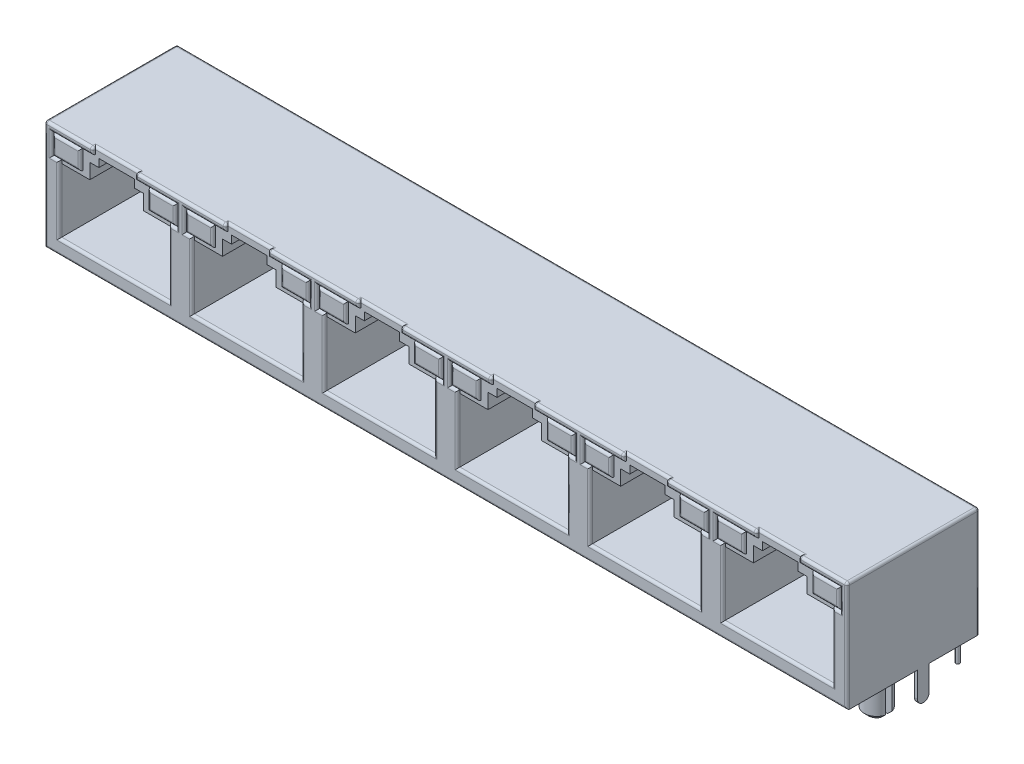
from build123d import *

# Parameters (mm, degrees)
SKETCH_1_W          = 95.25
SKETCH_1_H          = 15.7
EXTRUDE_1_DEPTH     = 13.05
SKETCH_2_R          = 1.48
EXTRUDE_2_DEPTH     = 3.7
CUT_EXTRUDE_1_DEPTH = 13
CUT_EXTRUDE_2_DEPTH = 0.3
SKETCH_5_W          = 3.3
SKETCH_5_H          = 2.3
EXTRUDE_4_DEPTH     = 0.3
FILLET_2_R          = 0.3
EXTRUDE_5_DEPTH     = 0.35
EXTRUDE_START       = -0.35
EXTRUDE_6_DEPTH     = 0.35
EXTRUDE_7_DEPTH     = 0.35
CUT_EXTRUDE_4_DEPTH = 1.65
SKETCH_12_R         = 0.225
EXTRUDE_8_DEPTH     = 3.01
CHAMFER_1_SIZE      = 0.5
CUT_EXTRUDE_5_REACH = 114.88
FILLET_3_R          = 0.3


with BuildPart() as part:
    # 草图1 → 凸台-拉伸1 (new body)
    with BuildSketch(Plane(origin=(0, 0, 0), x_dir=(1, 0, 0), z_dir=(0, 1, 0))):
        with Locations((62.895283232, 7.85)):
            Rectangle(SKETCH_1_W, SKETCH_1_H)
    extrude(amount=EXTRUDE_1_DEPTH)

    # 草图2 → 凸台-拉伸2 (add)
    with BuildSketch(Plane.XZ):
        with Locations(Location((17.170283232, -5.4, 0), (0, 0, 90))):
            Circle(SKETCH_2_R)
        with Locations(Location((108.620283232, -5.4, 0), (0, 0, 90))):
            Circle(SKETCH_2_R)
    extrude(amount=EXTRUDE_2_DEPTH)

    # 草图3 → 切除-拉伸1 (cut)
    with BuildSketch(Plane.XY):
        Polygon((64.270283232, 1.76), (77.270283232, 1.76), (77.270283232, 9.32), (73.945283232, 9.32), (73.945283232, 11.11), (72.870283232, 11.11), (72.870283232, 12.05), (68.670283232, 12.05), (68.670283232, 11.11), (67.595283232, 11.11), (67.595283232, 9.32), (64.270283232, 9.32), align=None)
        Polygon((80.020283232, 1.76), (93.020283232, 1.76), (93.020283232, 9.32), (89.695283232, 9.32), (89.695283232, 11.11), (88.620283232, 11.11), (88.620283232, 12.05), (84.420283232, 12.05), (84.420283232, 11.11), (83.345283232, 11.11), (83.345283232, 9.32), (80.020283232, 9.32), align=None)
        Polygon((95.770283232, 1.76), (108.770283232, 1.76), (108.770283232, 9.32), (105.445283232, 9.32), (105.445283232, 11.11), (104.370283232, 11.11), (104.370283232, 12.05), (100.170283232, 12.05), (100.170283232, 11.11), (99.095283232, 11.11), (99.095283232, 9.32), (95.770283232, 9.32), align=None)
        Polygon((48.520283232, 1.76), (61.520283232, 1.76), (61.520283232, 9.32), (58.195283232, 9.32), (58.195283232, 11.11), (57.120283232, 11.11), (57.120283232, 12.05), (52.920283232, 12.05), (52.920283232, 11.11), (51.845283232, 11.11), (51.845283232, 9.32), (48.520283232, 9.32), align=None)
        Polygon((32.770283232, 1.76), (45.770283232, 1.76), (45.770283232, 9.32), (42.445283232, 9.32), (42.445283232, 11.11), (41.370283232, 11.11), (41.370283232, 12.05), (37.170283232, 12.05), (37.170283232, 11.11), (36.095283232, 11.11), (36.095283232, 9.32), (32.770283232, 9.32), align=None)
        Polygon((17.020283232, 1.76), (30.020283232, 1.76), (30.020283232, 9.32), (26.695283232, 9.32), (26.695283232, 11.11), (25.620283232, 11.11), (25.620283232, 12.05), (21.420283232, 12.05), (21.420283232, 11.11), (20.345283232, 11.11), (20.345283232, 9.32), (17.020283232, 9.32), align=None)
    extrude(amount=-CUT_EXTRUDE_1_DEPTH, mode=Mode.SUBTRACT)

    # 草图4 → 切除-拉伸2 (cut)
    with BuildSketch(Plane.XY):
        Polygon((21.020283232, 13.05), (26.020283232, 13.05), (26.020283232, 12.25), (30.920283232, 12.25), (30.920283232, 9.73), (30.020283232, 9.73), (30.020283232, 9.32), (17.020283232, 9.32), (17.020283232, 9.73), (16.120283232, 9.73), (16.120283232, 12.25), (21.020283232, 12.25), align=None)
        Polygon((36.770283232, 13.05), (41.770283232, 13.05), (41.770283232, 12.25), (46.670283232, 12.25), (46.670283232, 9.73), (45.770283232, 9.73), (45.770283232, 9.32), (32.770283232, 9.32), (32.770283232, 9.73), (31.870283232, 9.73), (31.870283232, 12.25), (36.770283232, 12.25), align=None)
        Polygon((52.520283232, 13.05), (57.520283232, 13.05), (57.520283232, 12.25), (62.420283232, 12.25), (62.420283232, 9.73), (61.520283232, 9.73), (61.520283232, 9.32), (48.520283232, 9.32), (48.520283232, 9.73), (47.620283232, 9.73), (47.620283232, 12.25), (52.520283232, 12.25), align=None)
        Polygon((68.270283232, 13.05), (73.270283232, 13.05), (73.270283232, 12.25), (78.170283232, 12.25), (78.170283232, 9.73), (77.270283232, 9.73), (77.270283232, 9.32), (64.270283232, 9.32), (64.270283232, 9.73), (63.370283232, 9.73), (63.370283232, 12.25), (68.270283232, 12.25), align=None)
        Polygon((84.020283232, 13.05), (89.020283232, 13.05), (89.020283232, 12.25), (93.920283232, 12.25), (93.920283232, 9.73), (93.020283232, 9.73), (93.020283232, 9.32), (80.020283232, 9.32), (80.020283232, 9.73), (79.120283232, 9.73), (79.120283232, 12.25), (84.020283232, 12.25), align=None)
        Polygon((99.770283232, 13.05), (104.770283232, 13.05), (104.770283232, 12.25), (109.670283232, 12.25), (109.670283232, 9.73), (108.770283232, 9.73), (108.770283232, 9.32), (95.770283232, 9.32), (95.770283232, 9.73), (94.870283232, 9.73), (94.870283232, 12.25), (99.770283232, 12.25), align=None)
    extrude(amount=-CUT_EXTRUDE_2_DEPTH, mode=Mode.SUBTRACT)

    # 草图5 → 凸台-拉伸4 (add)
    with BuildSketch(Plane.XY.offset(-0.3)):
        with Locations((44.920283232, 11)):
            Rectangle(SKETCH_5_W, SKETCH_5_H)
        with Locations((29.170283232, 11)):
            Rectangle(SKETCH_5_W, SKETCH_5_H)
        with Locations((17.870283232, 11)):
            Rectangle(SKETCH_5_W, SKETCH_5_H)
        with Locations((33.620283232, 11)):
            Rectangle(SKETCH_5_W, SKETCH_5_H)
        with Locations((60.670283232, 11)):
            Rectangle(SKETCH_5_W, SKETCH_5_H)
        with Locations((49.370283232, 11)):
            Rectangle(SKETCH_5_W, SKETCH_5_H)
        with Locations((76.420283232, 11)):
            Rectangle(SKETCH_5_W, SKETCH_5_H)
        with Locations((65.120283232, 11)):
            Rectangle(SKETCH_5_W, SKETCH_5_H)
        with Locations((92.170283232, 11)):
            Rectangle(SKETCH_5_W, SKETCH_5_H)
        with Locations((80.870283232, 11)):
            Rectangle(SKETCH_5_W, SKETCH_5_H)
        with Locations((107.920283232, 11)):
            Rectangle(SKETCH_5_W, SKETCH_5_H)
        with Locations((96.620283232, 11)):
            Rectangle(SKETCH_5_W, SKETCH_5_H)
    extrude(amount=EXTRUDE_4_DEPTH)

    # 圆角2
    fillet_2_edges = [part.edges().sort_by_distance(p)[0] for p in [
        (106.270283232, 11, 0),
        (107.920283232, 12.15, 0),
        (109.570283232, 11, 0),
        (107.920283232, 9.85, 0),
        (96.620283232, 9.85, 0),
        (94.970283232, 11, 0),
        (96.620283232, 12.15, 0),
        (98.270283232, 11, 0),
        (90.520283232, 11, 0),
        (92.170283232, 12.15, 0),
        (93.820283232, 11, 0),
        (92.170283232, 9.85, 0),
        (80.870283232, 9.85, 0),
        (79.220283232, 11, 0),
        (80.870283232, 12.15, 0),
        (82.520283232, 11, 0),
        (74.770283232, 11, 0),
        (76.420283232, 12.15, 0),
        (78.070283232, 11, 0),
        (76.420283232, 9.85, 0),
        (65.120283232, 9.85, 0),
        (63.470283232, 11, 0),
        (65.120283232, 12.15, 0),
        (66.770283232, 11, 0),
        (59.020283232, 11, 0),
        (60.670283232, 12.15, 0),
        (62.320283232, 11, 0),
        (60.670283232, 9.85, 0),
        (49.370283232, 9.85, 0),
        (47.720283232, 11, 0),
        (49.370283232, 12.15, 0),
        (51.020283232, 11, 0),
        (43.270283232, 11, 0),
        (44.920283232, 12.15, 0),
        (46.570283232, 11, 0),
        (44.920283232, 9.85, 0),
        (33.620283232, 9.85, 0),
        (31.970283232, 11, 0),
        (33.620283232, 12.15, 0),
        (35.270283232, 11, 0),
        (27.520283232, 11, 0),
        (29.170283232, 12.15, 0),
        (30.820283232, 11, 0),
        (29.170283232, 9.85, 0),
        (17.870283232, 9.85, 0),
        (16.220283232, 11, 0),
        (17.870283232, 12.15, 0),
        (19.520283232, 11, 0),
    ]]
    fillet(fillet_2_edges, radius=FILLET_2_R - 0.0001)  # a hair under: the kernel refuses the full size

    # 草图8 → 凸台-拉伸5 (add)
    with BuildSketch(Plane.ZY.offset(-15.270283232)):
        with BuildLine():
            Line((-9.72, 0), (-9.72, -3.01))
            ThreePointArc((-9.72, -3.01), (-9.03, -3.7), (-8.34, -3.01))
            Line((-8.34, -3.01), (-8.34, 0))
            Line((-8.34, 0), (-9.72, 0))
        make_face()
    extrude(amount=-EXTRUDE_5_DEPTH)

    # 草图9 → 凸台-拉伸6 (add)
    with BuildSketch(Plane(origin=(110.520283232, 0, 0), x_dir=(0, 0, -1), z_dir=(1, 0, 0)).offset(EXTRUDE_START)):
        with BuildLine():
            Line((9.72, -3.01), (9.72, 0))
            Line((9.72, 0), (8.34, 0))
            Line((8.34, 0), (8.34, -3.01))
            ThreePointArc((8.34, -3.01), (9.03, -3.7), (9.72, -3.01))
        make_face()
    extrude(amount=EXTRUDE_6_DEPTH)

    # 草图10 → 凸台-拉伸7 (add)
    with BuildSketch(Plane(origin=(0, 0, -15.7), x_dir=(-1, 0, 0), z_dir=(0, 0, -1))):
        with BuildLine():
            Line((-54.290283232, 0), (-55.750283232, 0))
            Line((-55.750283232, 0), (-55.750283232, -2.97))
            ThreePointArc((-55.750283232, -2.97), (-55.020283232, -3.7), (-54.290283232, -2.97))
            Line((-54.290283232, -2.97), (-54.290283232, 0))
        make_face()
        with BuildLine():
            Line((-70.040283232, -2.97), (-70.040283232, 0))
            Line((-70.040283232, 0), (-71.500283232, 0))
            Line((-71.500283232, 0), (-71.500283232, -2.97))
            ThreePointArc((-71.500283232, -2.97), (-70.770283232, -3.7), (-70.040283232, -2.97))
        make_face()
    extrude(amount=-EXTRUDE_7_DEPTH)

    # 草图11 → 切除-拉伸4 (cut)
    with BuildSketch(Plane.XZ):
        Polygon((70.770283232, -11.2), (66.885283232, -11.2), (66.885283232, -15.7), (70.040283232, -15.7), (70.040283232, -15.35), (71.500283232, -15.35), (71.500283232, -15.7), (74.655283232, -15.7), (74.655283232, -11.2), align=None)
        Polygon((55.020283232, -11.2), (51.135283232, -11.2), (51.135283232, -15.7), (54.290283232, -15.7), (54.290283232, -15.35), (55.750283232, -15.35), (55.750283232, -15.7), (58.905283232, -15.7), (58.905283232, -11.2), align=None)
        Polygon((86.520283232, -11.2), (82.635283232, -11.2), (82.635283232, -15.7), (90.405283232, -15.7), (90.405283232, -11.2), align=None)
        Polygon((102.270283232, -11.2), (98.385283232, -11.2), (98.385283232, -15.7), (106.155283232, -15.7), (106.155283232, -11.2), align=None)
        Polygon((39.270283232, -11.2), (35.385283232, -11.2), (35.385283232, -15.7), (43.155283232, -15.7), (43.155283232, -11.2), align=None)
        Polygon((23.520283232, -11.2), (19.635283232, -11.2), (19.635283232, -15.7), (27.405283232, -15.7), (27.405283232, -11.2), align=None)
    extrude(amount=-CUT_EXTRUDE_4_DEPTH, mode=Mode.SUBTRACT)

    # 草图12 → 凸台-拉伸8 (add)
    with BuildSketch(Plane.XZ):
        with Locations(Location((23.010283232, -7.94, 0), (0, 0, 90))):
            Circle(SKETCH_12_R)
        with Locations(Location((24.030283232, -9.72, 0), (0, 0, 90))):
            Circle(SKETCH_12_R)
        with Locations(Location((25.050283232, -7.94, 0), (0, 0, 90))):
            Circle(SKETCH_12_R)
        with Locations(Location((27.090283232, -7.94, 0), (0, 0, 90))):
            Circle(SKETCH_12_R)
        with Locations(Location((20.970283232, -7.94, 0), (0, 0, 90))):
            Circle(SKETCH_12_R)
        with Locations(Location((21.990283232, -9.72, 0), (0, 0, 90))):
            Circle(SKETCH_12_R)
        with Locations(Location((19.950283232, -9.72, 0), (0, 0, 90))):
            Circle(SKETCH_12_R)
        with Locations(Location((26.070283232, -9.72, 0), (0, 0, 90))):
            Circle(SKETCH_12_R)
        with Locations(Location((18.950283232, -14.52, 0), (0, 0, 90))):
            Circle(SKETCH_12_R)
        with Locations(Location((16.660283232, -14.52, 0), (0, 0, 90))):
            Circle(SKETCH_12_R)
        with Locations(Location((30.380283232, -14.52, 0), (0, 0, 90))):
            Circle(SKETCH_12_R)
        with Locations(Location((28.090283232, -14.52, 0), (0, 0, 90))):
            Circle(SKETCH_12_R)
        with Locations(Location((34.700283232, -14.52, 0), (0, 0, 90))):
            Circle(SKETCH_12_R)
        with Locations(Location((32.410283232, -14.52, 0), (0, 0, 90))):
            Circle(SKETCH_12_R)
        with Locations(Location((46.130283232, -14.52, 0), (0, 0, 90))):
            Circle(SKETCH_12_R)
        with Locations(Location((43.840283232, -14.52, 0), (0, 0, 90))):
            Circle(SKETCH_12_R)
        with Locations(Location((50.450283232, -14.52, 0), (0, 0, 90))):
            Circle(SKETCH_12_R)
        with Locations(Location((48.160283232, -14.52, 0), (0, 0, 90))):
            Circle(SKETCH_12_R)
        with Locations(Location((61.880283232, -14.52, 0), (0, 0, 90))):
            Circle(SKETCH_12_R)
        with Locations(Location((59.590283232, -14.52, 0), (0, 0, 90))):
            Circle(SKETCH_12_R)
        with Locations(Location((66.200283232, -14.52, 0), (0, 0, 90))):
            Circle(SKETCH_12_R)
        with Locations(Location((63.910283232, -14.52, 0), (0, 0, 90))):
            Circle(SKETCH_12_R)
        with Locations(Location((77.630283232, -14.52, 0), (0, 0, 90))):
            Circle(SKETCH_12_R)
        with Locations(Location((75.340283232, -14.52, 0), (0, 0, 90))):
            Circle(SKETCH_12_R)
        with Locations(Location((81.950283232, -14.52, 0), (0, 0, 90))):
            Circle(SKETCH_12_R)
        with Locations(Location((79.660283232, -14.52, 0), (0, 0, 90))):
            Circle(SKETCH_12_R)
        with Locations(Location((93.380283232, -14.52, 0), (0, 0, 90))):
            Circle(SKETCH_12_R)
        with Locations(Location((91.090283232, -14.52, 0), (0, 0, 90))):
            Circle(SKETCH_12_R)
        with Locations(Location((97.700283232, -14.52, 0), (0, 0, 90))):
            Circle(SKETCH_12_R)
        with Locations(Location((95.410283232, -14.52, 0), (0, 0, 90))):
            Circle(SKETCH_12_R)
        with Locations(Location((109.130283232, -14.52, 0), (0, 0, 90))):
            Circle(SKETCH_12_R)
        with Locations(Location((106.840283232, -14.52, 0), (0, 0, 90))):
            Circle(SKETCH_12_R)
        with Locations(Location((38.760283232, -7.94, 0), (0, 0, 90))):
            Circle(SKETCH_12_R)
        with Locations(Location((39.780283232, -9.72, 0), (0, 0, 90))):
            Circle(SKETCH_12_R)
        with Locations(Location((40.800283232, -7.94, 0), (0, 0, 90))):
            Circle(SKETCH_12_R)
        with Locations(Location((42.840283232, -7.94, 0), (0, 0, 90))):
            Circle(SKETCH_12_R)
        with Locations(Location((36.720283232, -7.94, 0), (0, 0, 90))):
            Circle(SKETCH_12_R)
        with Locations(Location((37.740283232, -9.72, 0), (0, 0, 90))):
            Circle(SKETCH_12_R)
        with Locations(Location((35.700283232, -9.72, 0), (0, 0, 90))):
            Circle(SKETCH_12_R)
        with Locations(Location((41.820283232, -9.72, 0), (0, 0, 90))):
            Circle(SKETCH_12_R)
        with Locations(Location((54.510283232, -7.94, 0), (0, 0, 90))):
            Circle(SKETCH_12_R)
        with Locations(Location((55.530283232, -9.72, 0), (0, 0, 90))):
            Circle(SKETCH_12_R)
        with Locations(Location((56.550283232, -7.94, 0), (0, 0, 90))):
            Circle(SKETCH_12_R)
        with Locations(Location((58.590283232, -7.94, 0), (0, 0, 90))):
            Circle(SKETCH_12_R)
        with Locations(Location((52.470283232, -7.94, 0), (0, 0, 90))):
            Circle(SKETCH_12_R)
        with Locations(Location((53.490283232, -9.72, 0), (0, 0, 90))):
            Circle(SKETCH_12_R)
        with Locations(Location((51.450283232, -9.72, 0), (0, 0, 90))):
            Circle(SKETCH_12_R)
        with Locations(Location((57.570283232, -9.72, 0), (0, 0, 90))):
            Circle(SKETCH_12_R)
        with Locations(Location((70.260283232, -7.94, 0), (0, 0, 90))):
            Circle(SKETCH_12_R)
        with Locations(Location((71.280283232, -9.72, 0), (0, 0, 90))):
            Circle(SKETCH_12_R)
        with Locations(Location((72.300283232, -7.94, 0), (0, 0, 90))):
            Circle(SKETCH_12_R)
        with Locations(Location((74.340283232, -7.94, 0), (0, 0, 90))):
            Circle(SKETCH_12_R)
        with Locations(Location((68.220283232, -7.94, 0), (0, 0, 90))):
            Circle(SKETCH_12_R)
        with Locations(Location((69.240283232, -9.72, 0), (0, 0, 90))):
            Circle(SKETCH_12_R)
        with Locations(Location((67.200283232, -9.72, 0), (0, 0, 90))):
            Circle(SKETCH_12_R)
        with Locations(Location((73.320283232, -9.72, 0), (0, 0, 90))):
            Circle(SKETCH_12_R)
        with Locations(Location((86.010283232, -7.94, 0), (0, 0, 90))):
            Circle(SKETCH_12_R)
        with Locations(Location((87.030283232, -9.72, 0), (0, 0, 90))):
            Circle(SKETCH_12_R)
        with Locations(Location((88.050283232, -7.94, 0), (0, 0, 90))):
            Circle(SKETCH_12_R)
        with Locations(Location((90.090283232, -7.94, 0), (0, 0, 90))):
            Circle(SKETCH_12_R)
        with Locations(Location((83.970283232, -7.94, 0), (0, 0, 90))):
            Circle(SKETCH_12_R)
        with Locations(Location((84.990283232, -9.72, 0), (0, 0, 90))):
            Circle(SKETCH_12_R)
        with Locations(Location((82.950283232, -9.72, 0), (0, 0, 90))):
            Circle(SKETCH_12_R)
        with Locations(Location((89.070283232, -9.72, 0), (0, 0, 90))):
            Circle(SKETCH_12_R)
        with Locations(Location((101.760283232, -7.94, 0), (0, 0, 90))):
            Circle(SKETCH_12_R)
        with Locations(Location((102.780283232, -9.72, 0), (0, 0, 90))):
            Circle(SKETCH_12_R)
        with Locations(Location((103.800283232, -7.94, 0), (0, 0, 90))):
            Circle(SKETCH_12_R)
        with Locations(Location((105.840283232, -7.94, 0), (0, 0, 90))):
            Circle(SKETCH_12_R)
        with Locations(Location((99.720283232, -7.94, 0), (0, 0, 90))):
            Circle(SKETCH_12_R)
        with Locations(Location((100.740283232, -9.72, 0), (0, 0, 90))):
            Circle(SKETCH_12_R)
        with Locations(Location((98.700283232, -9.72, 0), (0, 0, 90))):
            Circle(SKETCH_12_R)
        with Locations(Location((104.820283232, -9.72, 0), (0, 0, 90))):
            Circle(SKETCH_12_R)
    extrude(amount=EXTRUDE_8_DEPTH)

    # 倒角1
    chamfer_1_edges = [part.edges().sort_by_distance(p)[0] for p in [
        (17.170283232, -3.7, -6.88),
        (108.620283232, -3.7, -6.88),
    ]]
    chamfer(chamfer_1_edges, length=CHAMFER_1_SIZE)

    # 切除-拉伸5: up to this face of the body (flat: up to its plane)
    cut_extrude_5_end = Plane(part.part.faces().sort_by_distance((62.895283232, 0, -6.91690901))[0])
    # 草图13 → 切除-拉伸5 (cut, up to the picked face)
    with BuildSketch(Plane.XZ.offset(3.7), mode=Mode.PRIVATE) as cut_extrude_5_sk1:
        Polygon((15.270283232, -5.4), (15.270283232, -5), (110.520283232, -5), (110.520283232, -5.8), (15.270283232, -5.8), align=None)
    cut_extrude_5_tool1 = split(extrude(cut_extrude_5_sk1.sketch, amount=-CUT_EXTRUDE_5_REACH, mode=Mode.PRIVATE), bisect_by=cut_extrude_5_end, keep=Keep.BOTH, mode=Mode.PRIVATE)
    add(cut_extrude_5_tool1.solids().sort_by(Axis((62.895283, -3.7, -5.4), (0, 1, 0)))[0], mode=Mode.SUBTRACT)

    # 圆角3
    fillet_3_edges = [part.edges().sort_by_distance(p)[0] for p in [
        (89.020283232, 13.05, -0.15),
        (86.520283232, 13.05, -0.3),
        (84.020283232, 13.05, -0.15),
        (73.270283232, 13.05, -0.15),
        (70.770283232, 13.05, -0.3),
        (68.270283232, 13.05, -0.15),
        (57.520283232, 13.05, -0.15),
        (55.020283232, 13.05, -0.3),
        (52.520283232, 13.05, -0.15),
        (41.770283232, 13.05, -0.15),
        (39.270283232, 13.05, -0.3),
        (36.770283232, 13.05, -0.15),
        (26.020283232, 13.05, -0.15),
        (23.520283232, 13.05, -0.3),
        (21.020283232, 13.05, -0.15),
        (15.270283232, 13.05, -7.85),
        (62.895283232, 13.05, -15.7),
        (110.520283232, 13.05, -7.85),
        (104.770283232, 13.05, -0.15),
        (102.270283232, 13.05, -0.3),
        (99.770283232, 13.05, -0.15),
        (102.270283232, 1.76, 0),
        (108.770283232, 5.745, 0),
        (109.220283232, 9.73, 0),
        (109.670283232, 10.99, 0),
        (107.220283232, 12.25, 0),
        (104.770283232, 12.65, 0),
        (107.645283232, 13.05, 0),
        (110.520283232, 6.525, 0),
        (62.895283232, 0, 0),
        (15.270283232, 6.525, 0),
        (18.145283232, 13.05, 0),
        (21.020283232, 12.65, 0),
        (18.570283232, 12.25, 0),
        (16.120283232, 10.99, 0),
        (16.570283232, 9.73, 0),
        (17.020283232, 5.745, 0),
        (23.520283232, 1.76, 0),
        (30.020283232, 5.745, 0),
        (30.470283232, 9.73, 0),
        (30.920283232, 10.99, 0),
        (28.470283232, 12.25, 0),
        (26.020283232, 12.65, 0),
        (31.395283232, 13.05, 0),
        (36.770283232, 12.65, 0),
        (34.320283232, 12.25, 0),
        (31.870283232, 10.99, 0),
        (32.320283232, 9.73, 0),
        (32.770283232, 5.745, 0),
        (39.270283232, 1.76, 0),
        (45.770283232, 5.745, 0),
        (46.220283232, 9.73, 0),
        (46.670283232, 10.99, 0),
        (44.220283232, 12.25, 0),
        (41.770283232, 12.65, 0),
        (47.145283232, 13.05, 0),
        (52.520283232, 12.65, 0),
        (50.070283232, 12.25, 0),
        (47.620283232, 10.99, 0),
        (48.070283232, 9.73, 0),
        (48.520283232, 5.745, 0),
        (55.020283232, 1.76, 0),
        (61.520283232, 5.745, 0),
        (61.970283232, 9.73, 0),
        (62.420283232, 10.99, 0),
        (59.970283232, 12.25, 0),
        (57.520283232, 12.65, 0),
        (62.895283232, 13.05, 0),
        (68.270283232, 12.65, 0),
        (65.820283232, 12.25, 0),
        (63.370283232, 10.99, 0),
        (63.820283232, 9.73, 0),
        (64.270283232, 5.745, 0),
        (70.770283232, 1.76, 0),
        (77.270283232, 5.745, 0),
        (77.720283232, 9.73, 0),
        (78.170283232, 10.99, 0),
        (75.720283232, 12.25, 0),
        (73.270283232, 12.65, 0),
        (78.645283232, 13.05, 0),
        (84.020283232, 12.65, 0),
        (81.570283232, 12.25, 0),
        (79.120283232, 10.99, 0),
        (79.570283232, 9.73, 0),
        (80.020283232, 5.745, 0),
        (86.520283232, 1.76, 0),
        (93.020283232, 5.745, 0),
        (93.470283232, 9.73, 0),
        (93.920283232, 10.99, 0),
        (91.470283232, 12.25, 0),
        (89.020283232, 12.65, 0),
        (94.395283232, 13.05, 0),
        (99.770283232, 12.65, 0),
        (97.320283232, 12.25, 0),
        (94.870283232, 10.99, 0),
        (95.320283232, 9.73, 0),
        (95.770283232, 5.745, 0),
        (110.520283232, 6.525, -15.7),
        (15.270283232, 6.525, -15.7),
    ]]
    fillet(fillet_3_edges, radius=FILLET_3_R - 0.0001)  # a hair under: the kernel refuses the full size


solid = part.part
